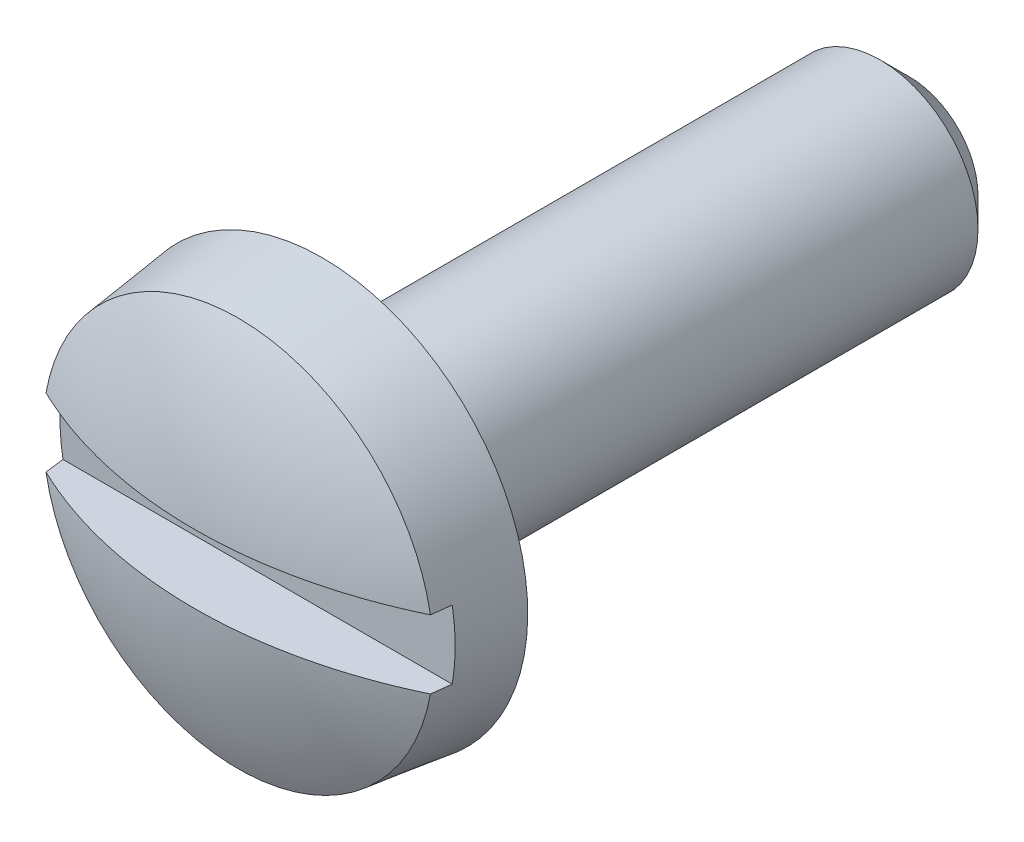
from build123d import *

# Parameters (mm, degrees)
SKETCH1_R       = 6.6675
EXTRUDE3_DEPTH  = 4.191
SKETCH4_W       = 19.05
SKETCH4_H       = 3.175
CHAMFER2_SIZE   = 0.9525
SKETCH31_W      = 13.335
SKETCH31_H      = 2.2225
EXTRUDE15_DEPTH = 2.0955


with BuildPart() as part:
    # Sketch1 → Extrude3 (new body)
    with BuildSketch(Plane.XY):
        Circle(SKETCH1_R)
    extrude(amount=EXTRUDE3_DEPTH)

    # Sketch11 → Cut-Revolve3 (revolve, cut)
    with BuildSketch(Plane(origin=(0, 0, 0), x_dir=(0, 0, -1), z_dir=(1, 0, 0))):
        with BuildLine():
            Line((-4.445, 6.9342), (0, 6.9342))
            Line((0, 6.9342), (0, 6.6675))
            Line((0, 6.6675), (-2.72415, 6.333016438))
            ThreePointArc((-2.72415, 6.333016438), (-3.819496854, 3.250336372), (-4.191, 0))
            Line((-4.191, 0), (-4.445, 0))
            Line((-4.445, 0), (-4.445, 6.9342))
        make_face()
    revolve(axis=Axis((0, 0, 0), (0, 0, 1)), mode=Mode.SUBTRACT)

    # Sketch31 → Extrude15 (cut)
    with BuildSketch(Plane.XY.offset(4.191)):
        Rectangle(SKETCH31_W, SKETCH31_H)
    extrude(amount=-EXTRUDE15_DEPTH, mode=Mode.SUBTRACT)


with BuildPart() as body_2:
    # Sketch4 → Revolve1 (revolve)
    with BuildSketch(Plane(origin=(0, 0, 0), x_dir=(0, 0, -1), z_dir=(1, 0, 0))):
        with Locations((9.525, 1.5875)):
            Rectangle(SKETCH4_W, SKETCH4_H)
    revolve(axis=Axis((0, 0, 0), (0, 0, -1)))

    # Chamfer2
    chamfer2_edges = [body_2.edges().sort_by_distance(p)[0] for p in [
        (0, -3.175, -19.05),
    ]]
    chamfer(chamfer2_edges, length=CHAMFER2_SIZE)


solid = Compound([part.part, body_2.part])
